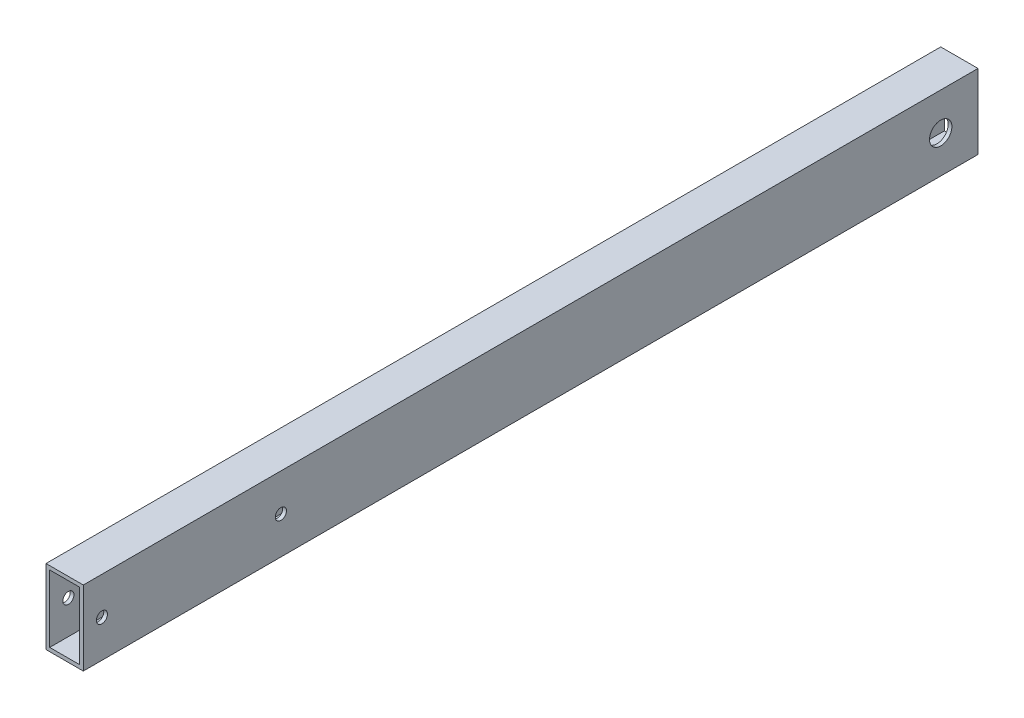
from build123d import *

# Parameters (mm, degrees)
SKETCH1_W           = 10
SKETCH1_H           = 20
SKETCH1_W_2         = 8
SKETCH1_H_2         = 18
BOSS_EXTRUDE1_DEPTH = 240
SKETCH2_R           = 3
SKETCH2_R_2         = 1.5
CUT_EXTRUDE1_DEPTH  = 241.416305603


with BuildPart() as part:
    # Sketch1 → Boss-Extrude1 (new body)
    with BuildSketch(Plane.XY):
        Rectangle(SKETCH1_W, SKETCH1_H)
        Rectangle(SKETCH1_W_2, SKETCH1_H_2, mode=Mode.SUBTRACT)
    extrude(amount=BOSS_EXTRUDE1_DEPTH)

    # Sketch2 → Cut-Extrude1 (cut, through all)
    with BuildSketch(Plane(origin=(5, 0, 0), x_dir=(0, 0, -1), z_dir=(1, 0, 0))):
        with Locations((-10, 0)):
            Circle(SKETCH2_R)
        with Locations((-235, 0)):
            Circle(SKETCH2_R_2)
        with Locations((-187, 0)):
            Circle(SKETCH2_R_2)
    extrude(amount=-CUT_EXTRUDE1_DEPTH, mode=Mode.SUBTRACT)


solid = part.part
